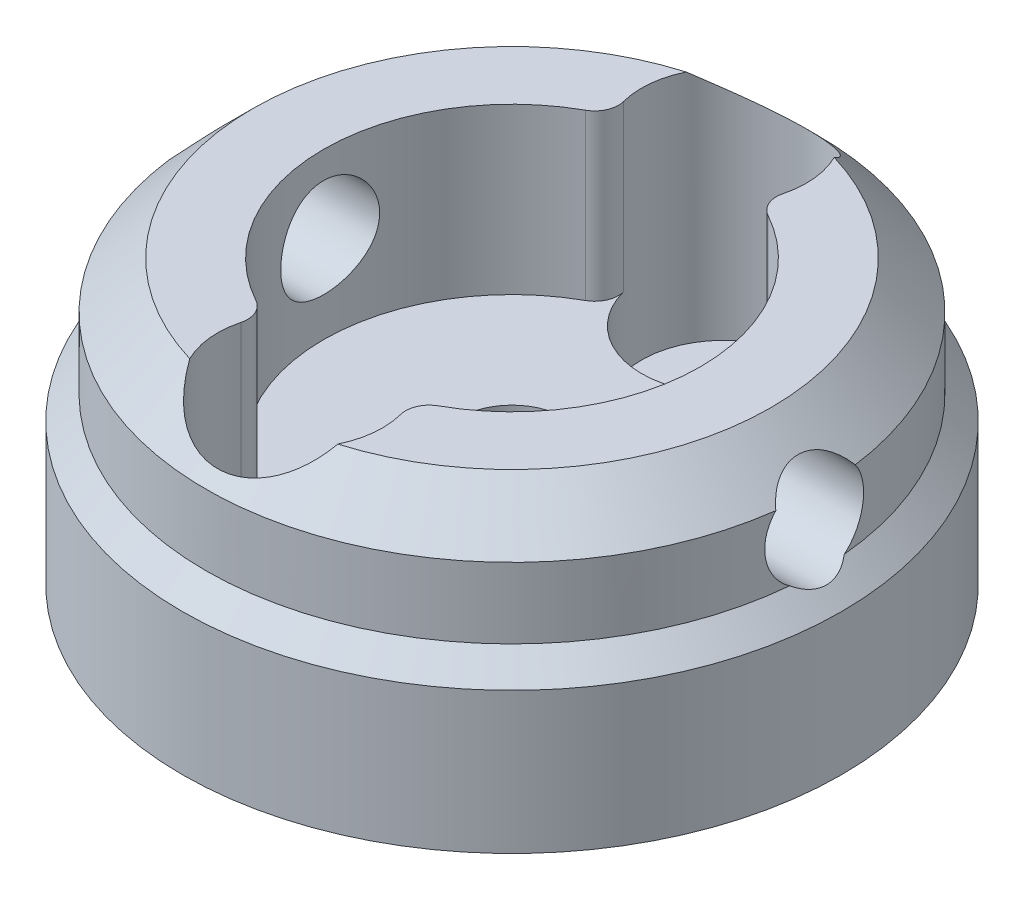
from build123d import *

# Parameters (mm, degrees)
SKETCH1_R               = 14
SKETCH1_R_2             = 2.25
BOSS_EXTRUDE1_DEPTH     = 5
SKETCH2_R               = 1.5
CUT_EXTRUDE1_DEPTH      = 21.420577857
SKETCH4_R               = 3.5
CUT_EXTRUDE2_DEPTH      = 3
CIRPATTERN1_COUNT       = 2
SKETCH5_R               = 13
SKETCH5_R_2             = 8
BOSS_EXTRUDE2_DEPTH     = 7
SKETCH6_R               = 3.5
CUT_EXTRUDE3_DEPTH      = 22
CHAMFER1_SIZE           = 2
FILLET1_START           = 5
FILLET1_DEPTH           = 8
CUT_EXTRUDE4_DEPTH      = 24.151673806
CUT_EXTRUDE4_DEPTH_BACK = 24.151673806
SKETCH8_R               = 2.1
CHAMFER2_SIZE           = 2


with BuildPart() as part:
    # Sketch1 → Boss-Extrude1 (new body)
    with BuildSketch(Plane(origin=(0, 0, 0), x_dir=(1, 0, 0), z_dir=(0, 1, 0))):
        with Locations(Location((0, 0, 0), (0, 0, 270))):
            Circle(SKETCH1_R)
        with Locations(Location((0, 0, 0), (0, 0, 270))):
            Circle(SKETCH1_R_2, mode=Mode.SUBTRACT)
    extrude(amount=BOSS_EXTRUDE1_DEPTH)

    # Sketch2 → Cut-Extrude1 (cut, through all)
    with BuildSketch(Plane(origin=(0, 5, 0), x_dir=(1, 0, 0), z_dir=(0, 1, 0))):
        with Locations(Location((0, 9, 0), (0, 0, 270))):
            Circle(SKETCH2_R)
    cut_extrude1 = extrude(amount=-CUT_EXTRUDE1_DEPTH, mode=Mode.SUBTRACT)

    # Sketch4 → Cut-Extrude2 (cut)
    with BuildSketch(Plane(origin=(0, 5, 0), x_dir=(1, 0, 0), z_dir=(0, 1, 0))):
        with Locations(Location((0, 9, 0), (0, 0, 270))):
            Circle(SKETCH4_R)
    cut_extrude2 = extrude(amount=-CUT_EXTRUDE2_DEPTH, mode=Mode.SUBTRACT)

    # CirPattern1: Cut-Extrude1, Cut-Extrude2 ×2 about axis
    cirpattern1_axis = Axis((0, 0, 0), (0, 1, 0))
    add([cut_extrude1.rotate(cirpattern1_axis, i * 360 / CIRPATTERN1_COUNT) for i in range(1, CIRPATTERN1_COUNT)], mode=Mode.SUBTRACT)
    add([cut_extrude2.rotate(cirpattern1_axis, i * 360 / CIRPATTERN1_COUNT) for i in range(1, CIRPATTERN1_COUNT)], mode=Mode.SUBTRACT)

    # Sketch5 → Boss-Extrude2 (add)
    with BuildSketch(Plane(origin=(0, 5, 0), x_dir=(1, 0, 0), z_dir=(0, 1, 0))):
        with Locations(Location((0, 0, 0), (0, 0, 270))):
            Circle(SKETCH5_R)
        with Locations(Location((0, 0, 0), (0, 0, 112.7982481))):
            Circle(SKETCH5_R_2, mode=Mode.SUBTRACT)
    extrude(amount=BOSS_EXTRUDE2_DEPTH)

    # Sketch6 → Cut-Extrude3 (cut, through all)
    with BuildSketch(Plane(origin=(0, 5, 0), x_dir=(1, 0, 0), z_dir=(0, 1, 0))):
        with Locations(Location((0, 9, 0), (0, 0, 270))):
            Circle(SKETCH6_R)
        with Locations(Location((0, -9, 0), (0, 0, 27.664004496))):
            Circle(SKETCH6_R)
    extrude(amount=CUT_EXTRUDE3_DEPTH, mode=Mode.SUBTRACT)

    # Chamfer1
    # the kernel refuses this chamfer: 2 mm, written as the material it adds along each edge
    with BuildSketch(Plane(origin=(0, 5, 0), x_dir=(0, 0, 1), z_dir=(-1, 0, 0))) as chamfer1_piece_1_section:
        Polygon((13 + CHAMFER1_SIZE, 0), (13, CHAMFER1_SIZE), (13, 0), align=None)
    chamfer1_piece_1 = revolve(axis=Axis((0, 5, 0), (0, 1, 0)), mode=Mode.PRIVATE)
    chamfer1_piece_1 = chamfer1_piece_1 & Plane(origin=(0, 5, 0), x_dir=(0, 0, 1), z_dir=(0, -1, 0)) * Cylinder(14, 61, mode=Mode.PRIVATE)
    add(chamfer1_piece_1)

    # Fillet1: read off the stored shape, not the designer's step
    # Fillet1 outline → Fillet1 (cut)
    with BuildSketch(Plane(origin=(0, 0, 0), x_dir=(1, 0, 0), z_dir=(0, 1, 0)).offset(FILLET1_START)):
        with BuildLine():
            ThreePointArc((3.388860428, -8.125), (3.438547611, -7.479715292), (3.872983346, -7))
            ThreePointArc((3.872983346, -7), (3.491479482, -7.197886567), (3.099899192, -7.375))
            ThreePointArc((3.099899192, -7.375), (3.265979999, -7.741677844), (3.388860428, -8.125))
        make_face()
        with BuildLine():
            ThreePointArc((3.099899192, 7.375), (3.491479482, 7.197886567), (3.872983346, 7))
            ThreePointArc((3.872983346, 7), (3.438547611, 7.479715292), (3.388860428, 8.125))
            ThreePointArc((3.388860428, 8.125), (3.265979999, 7.741677844), (3.099899192, 7.375))
        make_face()
        with BuildLine():
            ThreePointArc((-3.388860428, -8.125), (-3.265979999, -7.741677844), (-3.099899192, -7.375))
            ThreePointArc((-3.099899192, -7.375), (-3.491479482, -7.197886567), (-3.872983346, -7))
            ThreePointArc((-3.872983346, -7), (-3.438547611, -7.479715292), (-3.388860428, -8.125))
        make_face()
        with BuildLine():
            ThreePointArc((-3.872983346, 7), (-3.491479482, 7.197886567), (-3.099899192, 7.375))
            ThreePointArc((-3.099899192, 7.375), (-3.265979999, 7.741677844), (-3.388860428, 8.125))
            ThreePointArc((-3.388860428, 8.125), (-3.438547611, 7.479715292), (-3.872983346, 7))
        make_face()
    extrude(amount=FILLET1_DEPTH, mode=Mode.SUBTRACT)

    # Sketch8 → Cut-Extrude4 (cut, two sides: drawn at the far end of the back side and taken through both)
    with BuildSketch(Plane(origin=(0, 0, 0), x_dir=(0, 0, -1), z_dir=(1, 0, 0)).offset(-CUT_EXTRUDE4_DEPTH_BACK)):
        with Locations((0, 8.75)):
            Circle(SKETCH8_R)
    extrude(amount=CUT_EXTRUDE4_DEPTH + CUT_EXTRUDE4_DEPTH_BACK, mode=Mode.SUBTRACT)

    # Chamfer2
    # the kernel refuses this chamfer: 2 mm, written as the material it takes off along each edge
    with BuildSketch(Plane(origin=(0, 12, 0), x_dir=(0, 0, 1), z_dir=(-1, 0, 0))) as chamfer2_piece_1:
        Polygon((13, -CHAMFER2_SIZE), (13 - CHAMFER2_SIZE, 0), (13, 0), align=None)
    revolve(axis=Axis((0, 12, 0), (0, 1, 0)), mode=Mode.SUBTRACT)


solid = part.part
